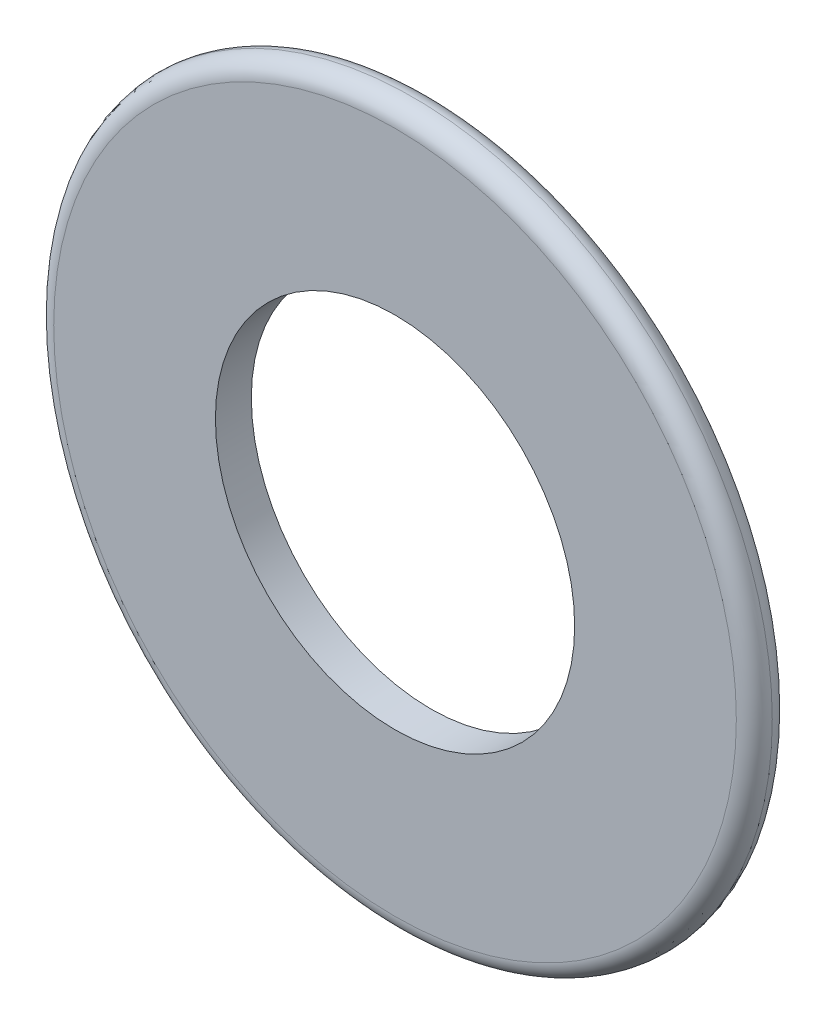
from build123d import *

# Parameters (mm, degrees)
SKETCH1_R           = 10
SKETCH1_R_2         = 5
BOSS_EXTRUDE1_DEPTH = 1
FILLET1_R           = 0.5


with BuildPart() as part:
    # Sketch1 → Boss-Extrude1 (new body)
    with BuildSketch(Plane.XY):
        Circle(SKETCH1_R)
        Circle(SKETCH1_R_2, mode=Mode.SUBTRACT)
    extrude(amount=BOSS_EXTRUDE1_DEPTH)

    # Fillet1
    fillet1_edges = [part.edges().sort_by_distance(p)[0] for p in [
        (-10, 0, 0),
        (-10, 0, 1),
    ]]
    fillet(fillet1_edges, radius=FILLET1_R - 0.0001)  # a hair under: the kernel refuses the full size


solid = part.part
